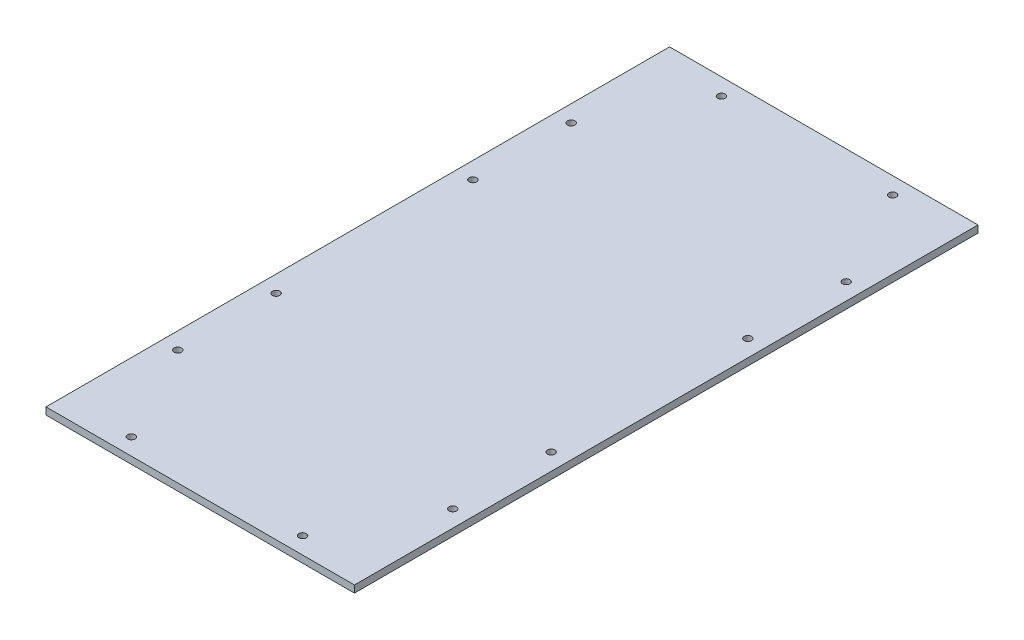
from build123d import *

# Parameters (mm, degrees)
SKETCH1_W           = 138.2
SKETCH1_H           = 279.4
SKETCH1_R           = 1.65
BOSS_EXTRUDE1_DEPTH = 3.175


with BuildPart() as part:
    # Sketch1 → Boss-Extrude1 (new body)
    with BuildSketch(Plane(origin=(0, 0, 0), x_dir=(1, 0, 0), z_dir=(0, 1, 0))):
        Rectangle(SKETCH1_W, SKETCH1_H)
        with Locations((-38.36, 132.2)):
            Circle(SKETCH1_R, mode=Mode.SUBTRACT)
        with Locations((-61.6, 88.133333333)):
            Circle(SKETCH1_R, mode=Mode.SUBTRACT)
        with Locations((-61.6, 44.066666667)):
            Circle(SKETCH1_R, mode=Mode.SUBTRACT)
        with Locations((61.6, 44.066666667)):
            Circle(SKETCH1_R, mode=Mode.SUBTRACT)
        with Locations((61.6, 88.133333333)):
            Circle(SKETCH1_R, mode=Mode.SUBTRACT)
        with Locations((38.36, 132.2)):
            Circle(SKETCH1_R, mode=Mode.SUBTRACT)
        with Locations((38.36, -132.2)):
            Circle(SKETCH1_R, mode=Mode.SUBTRACT)
        with Locations((61.6, -88.133333333)):
            Circle(SKETCH1_R, mode=Mode.SUBTRACT)
        with Locations((61.6, -44.066666667)):
            Circle(SKETCH1_R, mode=Mode.SUBTRACT)
        with Locations((-61.6, -44.066666667)):
            Circle(SKETCH1_R, mode=Mode.SUBTRACT)
        with Locations((-61.6, -88.133333333)):
            Circle(SKETCH1_R, mode=Mode.SUBTRACT)
        with Locations((-38.36, -132.2)):
            Circle(SKETCH1_R, mode=Mode.SUBTRACT)
    extrude(amount=BOSS_EXTRUDE1_DEPTH)


solid = part.part
